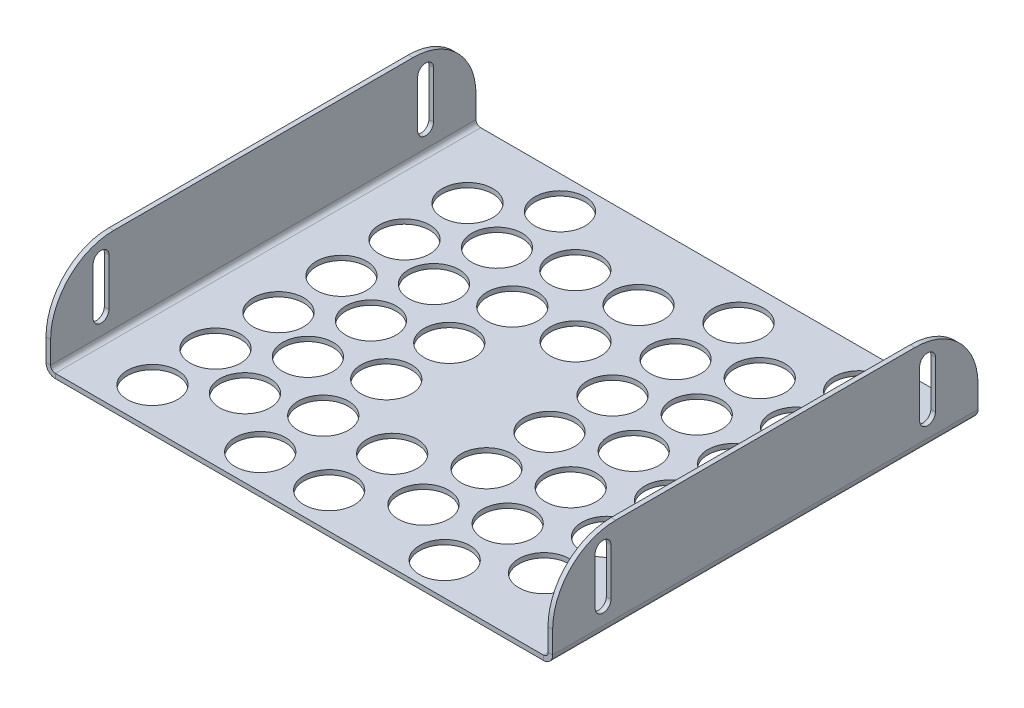
from build123d import *

# Parameters (mm, degrees)
SKETCH1_W               = 76.9234
SKETCH1_H               = 67.5
BASE_FLANGE1_DEPTH      = 0.7366
EDGE_FLANGE1_DEPTH      = 67.5
EDGE_FLANGE1_BEND_DEPTH = 67.5
CUT_EXTRUDE1_DEPTH      = 89.757105022
FILLET1_R               = 10
SKETCH14_R              = 4
CUT_EXTRUDE2_DEPTH      = 10


# Sheet-metal steps are written as plain solids
with BuildPart() as part:
    # Sketch1 → Base-Flange1 (new body)
    with BuildSketch(Plane(origin=(0, 0, 0), x_dir=(1, 0, 0), z_dir=(0, 1, 0))):
        with Locations((-8.2804, -1.046060421)):
            Rectangle(SKETCH1_W, SKETCH1_H)
    extrude(amount=-BASE_FLANGE1_DEPTH)

    # Edge-Flange1 section (across the edge) → Edge-Flange1 (add)
    with BuildSketch(Plane(origin=(31.1813, 0, 34.796060421), x_dir=(-1, 0, 0), z_dir=(0, 0, -1))):
        with BuildLine():
            Line((-0.7366, 0.7366), (-0.7366, 14.2634))
            Line((-0.7366, 14.2634), (0, 14.2634))
            Line((0, 14.2634), (0, 0.7366))
            ThreePointArc((0, 0.7366), (0.215745145, 0.215745145), (0.7366, 0))
            Line((0.7366, 0), (1, 0))
            Line((1, 0), (1, -0.7366))
            Line((1, -0.7366), (0.7366, -0.7366))
            ThreePointArc((0.7366, -0.7366), (-0.30510971, -0.30510971), (-0.7366, 0.7366))
        make_face()
    extrude(amount=EDGE_FLANGE1_DEPTH)

    # Edge-Flange1 section 2 (across the edge) → Edge-Flange1 bend (add)
    with BuildSketch(Plane(origin=(-47.7421, 0, -32.703939579), x_dir=(1, 0, 0), z_dir=(0, 0, 1))):
        with BuildLine():
            Line((-0.7366, 0.7366), (-0.7366, 14.2634))
            Line((-0.7366, 14.2634), (0, 14.2634))
            Line((0, 14.2634), (0, 0.7366))
            ThreePointArc((0, 0.7366), (0.215745145, 0.215745145), (0.7366, 0))
            Line((0.7366, 0), (1, 0))
            Line((1, 0), (1, -0.7366))
            Line((1, -0.7366), (0.7366, -0.7366))
            ThreePointArc((0.7366, -0.7366), (-0.30510971, -0.30510971), (-0.7366, 0.7366))
        make_face()
    extrude(amount=EDGE_FLANGE1_BEND_DEPTH)

    # Sketch13 → Cut-Extrude1 (cut, through all)
    with BuildSketch(Plane.ZY.offset(48.4787)):
        with BuildLine():
            Line((28.046060421, 11.2634), (28.046060421, 3.7634))
            ThreePointArc((28.046060421, 3.7634), (26.796060421, 2.5134), (25.546060421, 3.7634))
            Line((25.546060421, 3.7634), (25.546060421, 11.2634))
            ThreePointArc((25.546060421, 11.2634), (26.796060421, 12.5134), (28.046060421, 11.2634))
        make_face()
        with BuildLine():
            Line((-23.453939579, 11.2634), (-23.453939579, 3.7634))
            ThreePointArc((-23.453939579, 3.7634), (-24.703939579, 2.5134), (-25.953939579, 3.7634))
            Line((-25.953939579, 3.7634), (-25.953939579, 11.2634))
            ThreePointArc((-25.953939579, 11.2634), (-24.703939579, 12.5134), (-23.453939579, 11.2634))
        make_face()
    extrude(amount=-CUT_EXTRUDE1_DEPTH, mode=Mode.SUBTRACT)

    # Fillet1
    fillet1_edges = [part.edges().sort_by_distance(p)[0] for p in [
        (31.5496, 14.2634, 34.796060421),
        (31.5496, 14.2634, -32.703939579),
        (-48.1104, 14.2634, -32.703939579),
        (-48.1104, 14.2634, 34.796060421),
    ]]
    fillet(fillet1_edges, radius=FILLET1_R)

    # Sketch14 → Cut-Extrude2 (cut)
    with BuildSketch(Plane(origin=(0, 0, 0), x_dir=(1, 0, 0), z_dir=(0, 1, 0))):
        with Locations(Location((-10.107825022, 20.865751953, 0), (0, 0, 270))):
            Circle(SKETCH14_R)
        with Locations(Location((-10.107825022, 10.865751953, 0), (0, 0, 270))):
            Circle(SKETCH14_R)
        with Locations(Location((-9.205793222, -19.134248047, 0), (0, 0, 270))):
            Circle(SKETCH14_R)
        with Locations(Location((-9.205793222, -29.134248047, 0), (0, 0, 270))):
            Circle(SKETCH14_R)
        with Locations(Location((19.247878072, 26.50663709, 0), (0, 0, 270))):
            Circle(SKETCH14_R)
        with Locations(Location((19.247878072, 16.50663709, 0), (0, 0, 270))):
            Circle(SKETCH14_R)
        with Locations(Location((19.247878072, 6.50663709, 0), (0, 0, 270))):
            Circle(SKETCH14_R)
        with Locations(Location((19.247878072, -3.49336291, 0), (0, 0, 270))):
            Circle(SKETCH14_R)
        with Locations(Location((19.247878072, -13.49336291, 0), (0, 0, 270))):
            Circle(SKETCH14_R)
        with Locations(Location((19.247878072, -23.49336291, 0), (0, 0, 270))):
            Circle(SKETCH14_R)
        with Locations(Location((9.55786408, 20.430678866, 0), (0, 0, 270))):
            Circle(SKETCH14_R)
        with Locations(Location((9.55786408, 10.430678866, 0), (0, 0, 270))):
            Circle(SKETCH14_R)
        with Locations(Location((9.55786408, 0.430678866, 0), (0, 0, 270))):
            Circle(SKETCH14_R)
        with Locations(Location((9.55786408, -9.569321134, 0), (0, 0, 270))):
            Circle(SKETCH14_R)
        with Locations(Location((9.55786408, -19.569321134, 0), (0, 0, 270))):
            Circle(SKETCH14_R)
        with Locations(Location((9.55786408, -29.569321134, 0), (0, 0, 270))):
            Circle(SKETCH14_R)
        with Locations(Location((0.26115317, 26.362129758, 0), (0, 0, 270))):
            Circle(SKETCH14_R)
        with Locations(Location((0.26115317, 16.362129758, 0), (0, 0, 270))):
            Circle(SKETCH14_R)
        with Locations(Location((0.26115317, 6.362129758, 0), (0, 0, 270))):
            Circle(SKETCH14_R)
        with Locations(Location((0.26115317, -3.637870242, 0), (0, 0, 270))):
            Circle(SKETCH14_R)
        with Locations(Location((0.26115317, -13.637870242, 0), (0, 0, 270))):
            Circle(SKETCH14_R)
        with Locations(Location((0.26115317, -23.637870242, 0), (0, 0, 270))):
            Circle(SKETCH14_R)
        with Locations(Location((-19.91735253, 20.63989034, 0), (0, 0, 270))):
            Circle(SKETCH14_R)
        with Locations(Location((-19.91735253, 10.63989034, 0), (0, 0, 270))):
            Circle(SKETCH14_R)
        with Locations(Location((-19.91735253, 0.63989034, 0), (0, 0, 270))):
            Circle(SKETCH14_R)
        with Locations(Location((-19.91735253, -9.36010966, 0), (0, 0, 270))):
            Circle(SKETCH14_R)
        with Locations(Location((-19.91735253, -19.36010966, 0), (0, 0, 270))):
            Circle(SKETCH14_R)
        with Locations(Location((-19.91735253, -29.36010966, 0), (0, 0, 270))):
            Circle(SKETCH14_R)
        with Locations(Location((-29.215531727, 27.503898239, 0), (0, 0, 270))):
            Circle(SKETCH14_R)
        with Locations(Location((-29.215531727, 17.503898239, 0), (0, 0, 270))):
            Circle(SKETCH14_R)
        with Locations(Location((-29.215531727, 7.503898239, 0), (0, 0, 270))):
            Circle(SKETCH14_R)
        with Locations(Location((-29.215531727, -2.496101761, 0), (0, 0, 270))):
            Circle(SKETCH14_R)
        with Locations(Location((-29.215531727, -12.496101761, 0), (0, 0, 270))):
            Circle(SKETCH14_R)
        with Locations(Location((-29.215531727, -22.496101761, 0), (0, 0, 270))):
            Circle(SKETCH14_R)
        with Locations(Location((-37.689197421, 21.302640913, 0), (0, 0, 270))):
            Circle(SKETCH14_R)
        with Locations(Location((-37.689197421, 11.302640913, 0), (0, 0, 270))):
            Circle(SKETCH14_R)
        with Locations(Location((-37.689197421, 1.302640913, 0), (0, 0, 270))):
            Circle(SKETCH14_R)
        with Locations(Location((-37.689197421, -8.697359087, 0), (0, 0, 270))):
            Circle(SKETCH14_R)
        with Locations(Location((-37.689197421, -18.697359087, 0), (0, 0, 270))):
            Circle(SKETCH14_R)
        with Locations(Location((-37.689197421, -28.697359087, 0), (0, 0, 270))):
            Circle(SKETCH14_R)
    extrude(amount=-CUT_EXTRUDE2_DEPTH, mode=Mode.SUBTRACT)


solid = part.part
